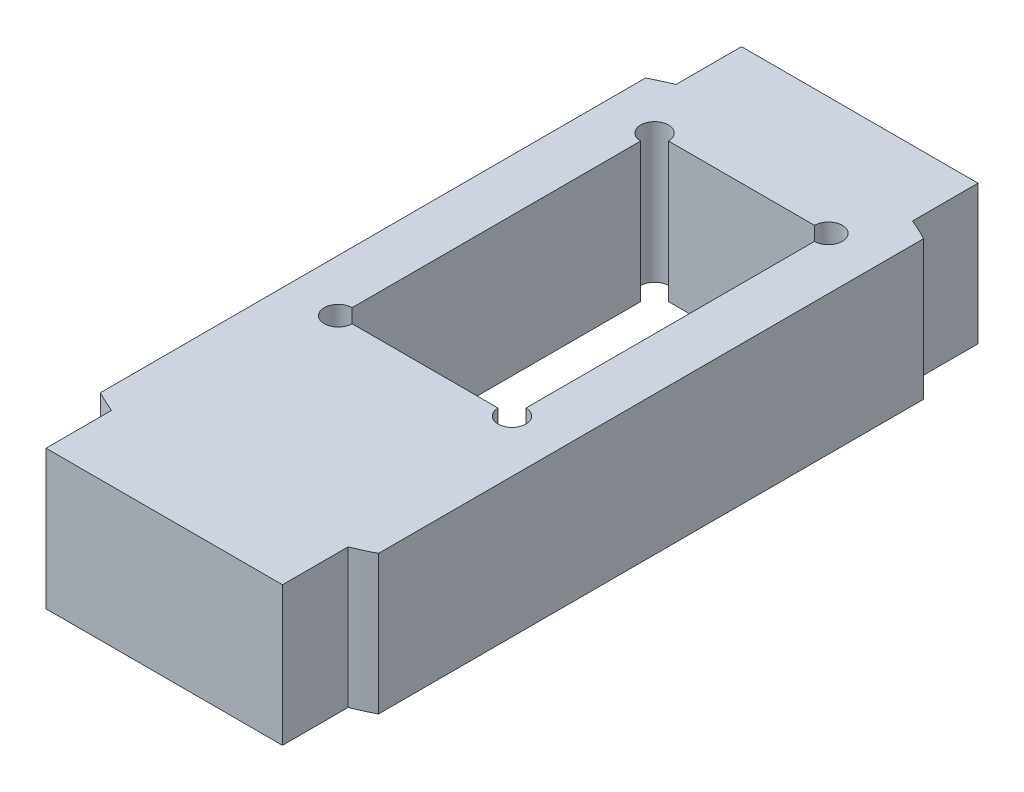
from build123d import *

# Parameters (mm, degrees)
RESSALTO_EXTRUS_O1_DEPTH = 10
CORTE_EXTRUS_O1_DEPTH    = 29.722813233


with BuildPart() as part:
    # Esboço1 → Ressalto-extrusão1 (new body)
    with BuildSketch(Plane(origin=(0, 0, 0), x_dir=(1, 0, 0), z_dir=(0, 1, 0))):
        with BuildLine():
            Line((-8.5, 20.291623888), (-8.5, 25))
            Line((-8.5, 25), (8.5, 25))
            Line((8.5, 25), (8.5, 20.291623888))
            ThreePointArc((8.5, 20.291623888), (9.256538321, 19.95786808), (10, 19.595917942))
            Line((10, 19.595917942), (10, -19.595917942))
            ThreePointArc((10, -19.595917942), (9.256538321, -19.95786808), (8.5, -20.291623888))
            Line((8.5, -20.291623888), (8.5, -25))
            Line((8.5, -25), (-8.5, -25))
            Line((-8.5, -25), (-8.5, -20.291623888))
            ThreePointArc((-8.5, -20.291623888), (-9.256538321, -19.95786808), (-10, -19.595917942))
            Line((-10, -19.595917942), (-10, 19.595917942))
            ThreePointArc((-10, 19.595917942), (-9.256538321, 19.95786808), (-8.5, 20.291623888))
        make_face()
    extrude(amount=RESSALTO_EXTRUS_O1_DEPTH)

    # Esboço2 → Corte-extrusão1 (cut, through all)
    with BuildSketch(Plane(origin=(0, 10, 0), x_dir=(1, 0, 0), z_dir=(0, 1, 0))):
        with BuildLine():
            Line((5.25, 16.5), (-5.25, 16.5))
            ThreePointArc((-5.25, 16.5), (-6.957106781, 17.207106781), (-6.25, 15.5))
            Line((-6.25, 15.5), (-6.25, -5.25))
            ThreePointArc((-6.25, -5.25), (-6.957106781, -6.957106781), (-5.25, -6.25))
            Line((-5.25, -6.25), (5.25, -6.25))
            ThreePointArc((5.25, -6.25), (6.957106781, -6.957106781), (6.25, -5.25))
            Line((6.25, -5.25), (6.25, 15.5))
            ThreePointArc((6.25, 15.5), (6.957106781, 17.207106781), (5.25, 16.5))
        make_face()
    extrude(amount=-CORTE_EXTRUS_O1_DEPTH, mode=Mode.SUBTRACT)


solid = part.part
